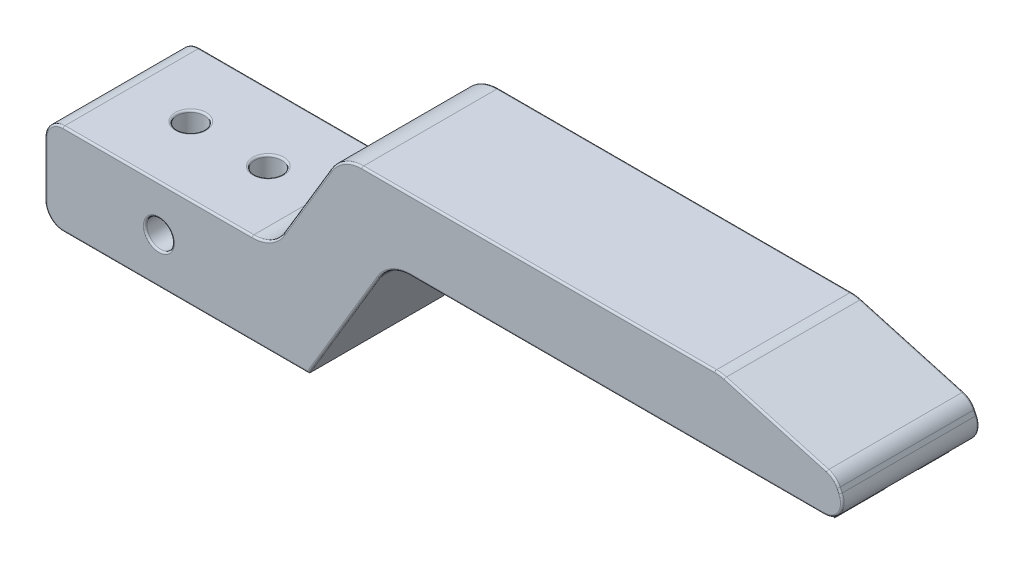
from build123d import *

# Parameters (mm, degrees)
ESQUISSE1_R             = 1.5
BOSS_EXTRU_1_DEPTH      = 15
CONG_1_R                = 2
CONG_3_R                = 4
CONG_5_R                = 4
CONG_6_R                = 2
ESQUISSE2_R             = 1.5
ENL_V_MAT_EXTRU_2_DEPTH = 65.716032438
CONG_8_R                = 0.2
BOSS_EXTRU_2_DEPTH      = 1
CONG_10_R               = 0.2
CONG_11_R               = 0.2
CONG_12_R               = 0.2


with BuildPart() as part:
    # Esquisse1 → Boss.-Extru.1 (new body)
    with BuildSketch(Plane.XY):
        Polygon((-20.961773966, 39.857997612), (14.688705186, 39.857997612), (29.918012986, 39.857997612), (27.8943161, 43.99468639), (15.279662568, 47.557997612), (-26.262708646, 47.557997612), (-33.770517971, 34.992735109), (-58.770517971, 34.992735109), (-58.770517971, 24.992735109), (-29.843845186, 24.992735109), align=None)
        with Locations((-46.270517971, 29.992735109)):
            Circle(ESQUISSE1_R, mode=Mode.SUBTRACT)
    extrude(amount=BOSS_EXTRU_1_DEPTH)

    # Congé1
    cong_1_edges = [part.edges().sort_by_distance(p)[0] for p in [
        (27.8943161, 43.99468639, 7.5),
        (29.918012986, 39.857997612, 7.5),
    ]]
    fillet(cong_1_edges, radius=CONG_1_R)

    # Congé3
    cong_3_edges = [part.edges().sort_by_distance(p)[0] for p in [
        (-20.961773966, 39.857997612, 7.5),
    ]]
    fillet(cong_3_edges, radius=CONG_3_R)

    # Congé5
    cong_5_edges = [part.edges().sort_by_distance(p)[0] for p in [
        (-26.262708646, 47.557997612, 7.5),
        (15.279662568, 47.557997612, 7.5),
        (-33.770517971, 34.992735109, 7.5),
    ]]
    fillet(cong_5_edges, radius=CONG_5_R)

    # Congé6
    cong_6_edges = [part.edges().sort_by_distance(p)[0] for p in [
        (-58.770517971, 24.992735109, 7.5),
        (-58.770517971, 34.992735109, 7.5),
    ]]
    fillet(cong_6_edges, radius=CONG_6_R)

    # Esquisse2 → Enlèv. mat.-Extru.2 (cut, through all)
    with BuildSketch(Plane.XZ.offset(-24.992735109)):
        with Locations((-50.270517971, 7.5)):
            Circle(ESQUISSE2_R)
        with Locations((-41.770517971, 7.5)):
            Circle(ESQUISSE2_R)
    extrude(amount=-ENL_V_MAT_EXTRU_2_DEPTH, mode=Mode.SUBTRACT)

    # Congé8
    cong_8_edges = [part.edges().sort_by_distance(p)[0] for p in [
        (-51.770517971, 34.992735109, 7.5),
        (-51.770517971, 24.992735109, 7.5),
        (-43.270517971, 34.992735109, 7.5),
        (-43.270517971, 24.992735109, 7.5),
    ]]
    fillet(cong_8_edges, radius=CONG_8_R)

    # Esquisse3 → Boss.-Extru.2 (add)
    with BuildSketch(Plane.XZ.offset(-39.857997612)):
        Polygon((-4.51576278, 13.8), (-10.17261703, 13.8), (-17.492159594, 6.480457436), (-17.492159594, 1.2), (-17.11576278, 1.2), align=None)
        Polygon((-0.980228874, 13.8), (4.676625375, 13.8), (-7.923374625, 1.2), (-13.580228874, 1.2), align=None)
        Polygon((8.212159281, 13.8), (13.869013531, 13.8), (1.269013531, 1.2), (-4.387840719, 1.2), align=None)
        Polygon((17.404547437, 13.8), (23.061401686, 13.8), (10.461401686, 1.2), (4.804547437, 1.2), align=None)
        Polygon((26.596935592, 13.8), (13.996935592, 1.2), (19.653789841, 1.2), (26.69733819, 8.243548348), (26.69733819, 13.8), align=None)
        Polygon((26.69733819, 4.708014442), (23.189323747, 1.2), (26.69733819, 1.2), align=None)
        Polygon((-13.708150936, 13.8), (-17.492159594, 10.015991342), (-17.492159594, 13.8), align=None)
    extrude(amount=BOSS_EXTRU_2_DEPTH)

    # Congé10
    cong_10_edges = [part.edges().sort_by_distance(p)[0] for p in [
        (-47.770517971, 29.992735109, 0),
        (-47.770517971, 29.992735109, 15),
    ]]
    fillet(cong_10_edges, radius=CONG_10_R)

    # Congé11
    cong_11_edges = [part.edges().sort_by_distance(p)[0] for p in [
        (-25.984875042, 31.451206648, 0),
        (-25.984875042, 31.451206648, 15),
        (28.39835911, 42.964359626, 0),
        (28.39835911, 42.964359626, 15),
        (21.423554114, 45.822508196, 0),
        (27.772163037, 43.848347647, 0),
        (28.409827678, 40.799168737, 0),
        (21.423554114, 45.822508196, 15),
        (27.772163037, 43.848347647, 15),
        (28.409827678, 40.799168737, 15),
        (4.010470704, 39.857997612, 0),
        (4.010470704, 39.857997612, 15),
        (-20.666150183, 39.336986136, 0),
        (-20.666150183, 39.336986136, 15),
        (-46.405325158, 34.992735109, 0),
        (-46.405325158, 34.992735109, 15),
        (-30.016613309, 41.27536636, 0),
        (-30.016613309, 41.27536636, 15),
        (-4.633769244, 47.557997612, 0),
        (-4.633769244, 47.557997612, 15),
        (-25.967084863, 47.036986136, 0),
        (15.274421325, 47.520161998, 0),
        (-25.967084863, 47.036986136, 15),
        (15.274421325, 47.520161998, 15),
        (-34.066141755, 35.513746584, 0),
        (-34.066141755, 35.513746584, 15),
        (-43.307181579, 24.992735109, 0),
        (-43.307181579, 24.992735109, 15),
        (-58.770517971, 29.992735109, 0),
        (-58.184731534, 34.406948671, 0),
        (-58.184731534, 25.578521546, 0),
        (-58.770517971, 29.992735109, 15),
        (-58.184731534, 34.406948671, 15),
        (-58.184731534, 25.578521546, 15),
    ]]
    fillet(cong_11_edges, radius=CONG_11_R)

    # Congé12
    # the kernel refuses this fillet: 0.2 mm, written as the material it takes off along each edge
    with BuildSketch(Plane(origin=(7.712159281, 38.857997612, 13.8), x_dir=(0, 1, 0), z_dir=(1, 0, 0)), Plane(origin=(-1.480228874, 38.857997612, 13.8), x_dir=(0, 1, 0), z_dir=(1, 0, 0)), Plane(origin=(16.904547437, 38.857997612, 13.8), x_dir=(0, 1, 0), z_dir=(1, 0, 0)), Plane(origin=(10.961401686, 38.857997612, 1.2), x_dir=(0, 1, 0), z_dir=(-1, 0, 0)), Plane(origin=(1.769013531, 38.857997612, 1.2), x_dir=(0, 1, 0), z_dir=(-1, 0, 0)), Plane(origin=(-7.423374625, 38.857997612, 1.2), x_dir=(0, 1, 0), z_dir=(-1, 0, 0))) as cong_12_piece_1:
        with BuildLine():
            CenterArc((CONG_12_R, -CONG_12_R), CONG_12_R, 90, 90)
            Line((0, -CONG_12_R), (0, 0))
            Line((0, 0), (CONG_12_R, 0))
        make_face()
    extrude(amount=6.656854249, mode=Mode.SUBTRACT)
    with BuildSketch(Plane(origin=(14.222566921, 38.857997612, 14.153553391), x_dir=(0, 1, 0), z_dir=(-0.7071067811865435, 0, -0.7071067811865516)), Plane(origin=(5.030178766, 38.857997612, 14.153553391), x_dir=(0, 1, 0), z_dir=(-0.7071067811865472, 0, -0.7071067811865479)), Plane(origin=(23.414955077, 38.857997612, 14.153553391), x_dir=(0, 1, 0), z_dir=(-0.7071067811865432, 0, -0.7071067811865519)), Plane(origin=(4.450994046, 38.857997612, 0.846446609), x_dir=(0, 1, 0), z_dir=(0.7071067811865431, 0, 0.7071067811865519)), Plane(origin=(-4.741394109, 38.857997612, 0.846446609), x_dir=(0, 1, 0), z_dir=(0.707106781186541, 0, 0.707106781186554)), Plane(origin=(-13.933782265, 38.857997612, 0.846446609), x_dir=(0, 1, 0), z_dir=(0.7071067811865476, 0, 0.7071067811865475))) as cong_12_piece_2:
        with BuildLine():
            CenterArc((CONG_12_R, -CONG_12_R), CONG_12_R, 90, 90)
            Line((0, -CONG_12_R), (0, 0))
            Line((0, 0), (CONG_12_R, 0))
        make_face()
    extrude(amount=18.819090886, mode=Mode.SUBTRACT)
    with BuildSketch(Plane(origin=(19.300236451, 38.857997612, 0.846446609), x_dir=(0, 1, 0), z_dir=(0.7071067811865434, 0, 0.7071067811865518))) as cong_12_piece_3:
        with BuildLine():
            CenterArc((CONG_12_R, CONG_12_R), CONG_12_R, 180, 90)
            Line((0, CONG_12_R), (0, 0))
            Line((0, 0), (CONG_12_R, 0))
        make_face()
    extrude(amount=10.961081601, mode=Mode.SUBTRACT)
    with BuildSketch(Plane(origin=(13.496935592, 38.857997612, 1.2), x_dir=(0, 1, 0), z_dir=(1, 0, 0)), Plane(origin=(-4.01576278, 38.857997612, 13.8), x_dir=(0, 1, 0), z_dir=(-1, 0, 0))) as cong_12_piece_4:
        with BuildLine():
            CenterArc((CONG_12_R, CONG_12_R), CONG_12_R, 180, 90)
            Line((0, CONG_12_R), (0, 0))
            Line((0, 0), (CONG_12_R, 0))
        make_face()
    extrude(amount=6.656854249, mode=Mode.SUBTRACT)
    with BuildSketch(Plane(origin=(26.950488983, 38.857997612, 14.153553391), x_dir=(0, 1, 0), z_dir=(-0.7071067811865431, 0, -0.7071067811865519)), Plane(origin=(-17.469316171, 38.857997612, 0.846446609), x_dir=(0, 1, 0), z_dir=(0.7071067811865476, 0, 0.7071067811865475))) as cong_12_piece_5:
        with BuildLine():
            CenterArc((CONG_12_R, CONG_12_R), CONG_12_R, 180, 90)
            Line((0, CONG_12_R), (0, 0))
            Line((0, 0), (CONG_12_R, 0))
        make_face()
    extrude(amount=18.819090886, mode=Mode.SUBTRACT)
    with BuildSketch(Plane(origin=(26.69733819, 38.857997612, 7.743548348), x_dir=(0, 1, 0), z_dir=(0, 0, 1))) as cong_12_piece_6:
        with BuildLine():
            CenterArc((CONG_12_R, CONG_12_R), CONG_12_R, 180, 90)
            Line((0, CONG_12_R), (0, 0))
            Line((0, 0), (CONG_12_R, 0))
        make_face()
    extrude(amount=6.556451652, mode=Mode.SUBTRACT)
    with BuildSketch(Plane(origin=(27.05089158, 38.857997612, 5.061567833), x_dir=(0, 1, 0), z_dir=(-0.707106781186543, 0, -0.7071067811865521))) as cong_12_piece_7:
        with BuildLine():
            CenterArc((CONG_12_R, CONG_12_R), CONG_12_R, 180, 90)
            Line((0, CONG_12_R), (0, 0))
            Line((0, 0), (CONG_12_R, 0))
        make_face()
    extrude(amount=5.961081601, mode=Mode.SUBTRACT)
    with BuildSketch(Plane(origin=(26.69733819, 38.857997612, 0.7), x_dir=(0, 1, 0), z_dir=(0, 0, 1)), Plane(origin=(22.689323747, 38.857997612, 1.2), x_dir=(0, 1, 0), z_dir=(1, 0, 0))) as cong_12_piece_8:
        with BuildLine():
            CenterArc((CONG_12_R, CONG_12_R), CONG_12_R, 180, 90)
            Line((0, CONG_12_R), (0, 0))
            Line((0, 0), (CONG_12_R, 0))
        make_face()
    extrude(amount=4.508014442, mode=Mode.SUBTRACT)
    with BuildSketch(Plane(origin=(-17.992159594, 38.857997612, 13.8), x_dir=(0, 1, 0), z_dir=(1, 0, 0)), Plane(origin=(-17.492159594, 38.857997612, 9.515991342), x_dir=(0, 1, 0), z_dir=(0, 0, 1))) as cong_12_piece_9:
        with BuildLine():
            CenterArc((CONG_12_R, -CONG_12_R), CONG_12_R, 90, 90)
            Line((0, -CONG_12_R), (0, 0))
            Line((0, 0), (CONG_12_R, 0))
        make_face()
    extrude(amount=4.784008658, mode=Mode.SUBTRACT)
    with BuildSketch(Plane(origin=(-13.354597545, 38.857997612, 14.153553391), x_dir=(0, 1, 0), z_dir=(-0.7071067811865476, 0, -0.7071067811865476))) as cong_12_piece_10:
        with BuildLine():
            CenterArc((CONG_12_R, -CONG_12_R), CONG_12_R, 90, 90)
            Line((0, -CONG_12_R), (0, 0))
            Line((0, 0), (CONG_12_R, 0))
        make_face()
    extrude(amount=6.351396364, mode=Mode.SUBTRACT)
    with BuildSketch(Plane(origin=(-9.819063639, 38.857997612, 14.153553391), x_dir=(0, 1, 0), z_dir=(-0.7071067811865476, 0, -0.7071067811865476))) as cong_12_piece_11:
        with BuildLine():
            CenterArc((CONG_12_R, CONG_12_R), CONG_12_R, 180, 90)
            Line((0, CONG_12_R), (0, 0))
            Line((0, 0), (CONG_12_R, 0))
        make_face()
    extrude(amount=11.351396364, mode=Mode.SUBTRACT)
    with BuildSketch(Plane(origin=(-17.992159594, 38.857997612, 1.2), x_dir=(0, 1, 0), z_dir=(1, 0, 0))) as cong_12_piece_12:
        with BuildLine():
            CenterArc((CONG_12_R, CONG_12_R), CONG_12_R, 180, 90)
            Line((0, CONG_12_R), (0, 0))
            Line((0, 0), (CONG_12_R, 0))
        make_face()
    extrude(amount=1.376396813, mode=Mode.SUBTRACT)
    with BuildSketch(Plane(origin=(-17.492159594, 38.857997612, 6.980457436), x_dir=(0, 1, 0), z_dir=(0, 0, -1))) as cong_12_piece_13:
        with BuildLine():
            CenterArc((CONG_12_R, CONG_12_R), CONG_12_R, 180, 90)
            Line((0, CONG_12_R), (0, 0))
            Line((0, 0), (CONG_12_R, 0))
        make_face()
    extrude(amount=6.280457436, mode=Mode.SUBTRACT)


solid = part.part
